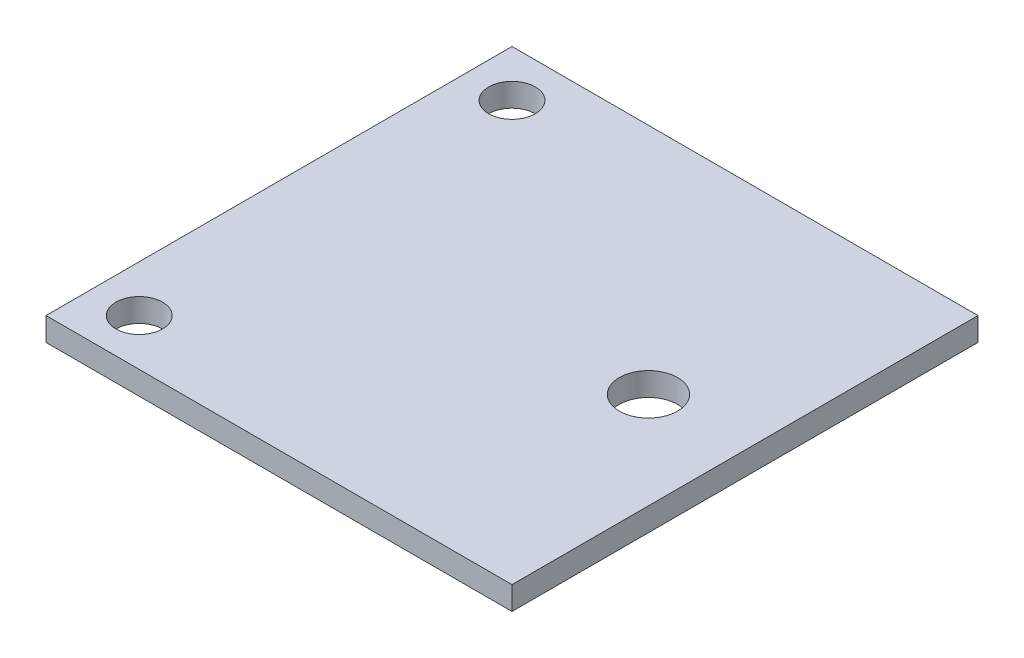
from build123d import *

# Parameters (mm, degrees)
SKETCH1_W           = 127
SKETCH1_H           = 127
SKETCH1_R           = 6.35
SKETCH1_R_2         = 7.9375
BOSS_EXTRUDE1_DEPTH = 6.35


with BuildPart() as part:
    # Sketch1 → Boss-Extrude1 (new body)
    with BuildSketch(Plane(origin=(0, 0, 0), x_dir=(1, 0, 0), z_dir=(0, 1, 0))):
        with Locations((63.5, 0)):
            Rectangle(SKETCH1_W, SKETCH1_H)
        with Locations((12.7, 50.8)):
            Circle(SKETCH1_R, mode=Mode.SUBTRACT)
        with Locations((12.7, -50.8)):
            Circle(SKETCH1_R, mode=Mode.SUBTRACT)
        with Locations((100.688181024, 0)):
            Circle(SKETCH1_R_2, mode=Mode.SUBTRACT)
    extrude(amount=BOSS_EXTRUDE1_DEPTH)


solid = part.part
